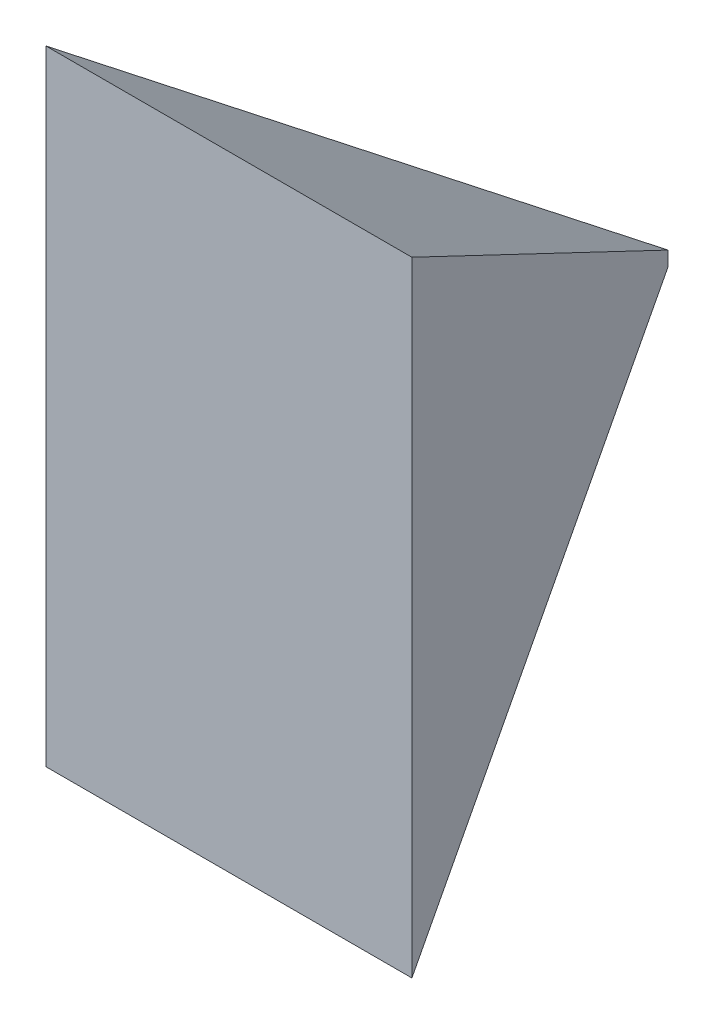
from build123d import *

# Parameters (mm, degrees)
BOSS_EXTRUDE1_DEPTH     = 42.65
CUT_EXTRUDE1_DEPTH      = 52.374368652
CUT_EXTRUDE1_DEPTH_BACK = 52.374368652


with BuildPart() as part:
    # Sketch3 → Boss-Extrude1 (new body)
    with BuildSketch(Plane(origin=(0, 0, 47.65), x_dir=(1, 0, 0), z_dir=(0, 1, 0))):
        Polygon((-12.5, 47.65), (0, 77.65), (12.5, 47.65), align=None)
    extrude(amount=BOSS_EXTRUDE1_DEPTH)

    # Sketch4 → Cut-Extrude1 (cut, two sides: drawn at the far end of the back side and taken through both)
    with BuildSketch(Plane(origin=(0, 0, -4.230769231), x_dir=(0, 0, -1), z_dir=(1, 0, 0)).offset(-CUT_EXTRUDE1_DEPTH_BACK)):
        Polygon((-4.230769231, 42.65), (25.769230769, 21.825), (25.769230769, 42.65), align=None)
        Polygon((-4.230769231, 0), (25.769230769, 0), (25.769230769, 20.825), align=None)
    extrude(amount=CUT_EXTRUDE1_DEPTH + CUT_EXTRUDE1_DEPTH_BACK, mode=Mode.SUBTRACT)


solid = part.part
